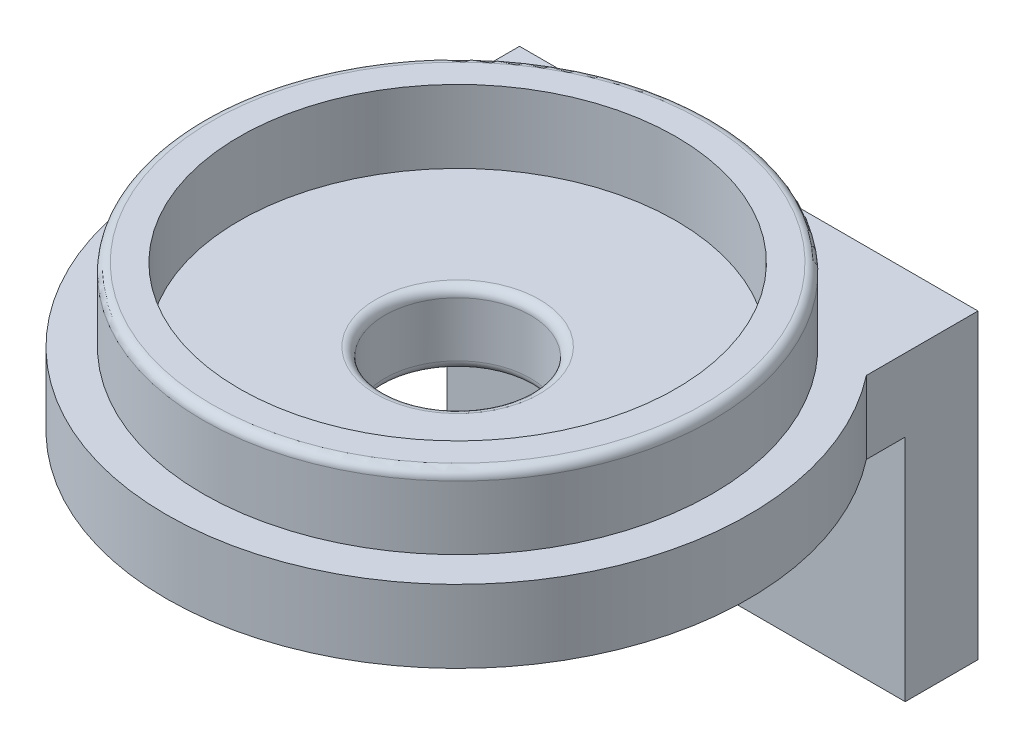
from build123d import *

# Parameters (mm, degrees)
FILLET1_R           = 0.79375
BOSS_EXTRUDE1_DEPTH = 20
SKETCH3_R           = 2.1
CUT_EXTRUDE1_DEPTH  = 57.196468922


with BuildPart() as part:
    # Sketch1 → Revolve1 (revolve)
    with BuildSketch(Plane(origin=(0, 0, 0), x_dir=(0, 0, -1), z_dir=(1, 0, 0))):
        Polygon((22.225, 9.525), (22.225, 3.175), (25.4, 3.175), (25.4, -3.175), (6.35, -3.175), (6.35, 3.175), (19.05, 3.175), (19.05, 9.525), align=None)
    revolve(axis=Axis((0, -32.325211936, 0), (0, 1, 0)))

    # Fillet1
    fillet1_edges = [part.edges().sort_by_distance(p)[0] for p in [
        (0, 9.525, 22.225),
        (0, -3.175, 6.35),
        (0, 3.175, 6.35),
    ]]
    fillet(fillet1_edges, radius=FILLET1_R)

    # Sketch2 → Boss-Extrude1 (add, symmetric)
    with BuildSketch(Plane(origin=(0, 0, 0), x_dir=(0, 0, -1), z_dir=(1, 0, 0))):
        Polygon((25.4, 3.175), (12.7, 3.175), (12.7, -3.175), (19.05, -3.175), (19.05, -23.174999878), (25.4, -23.174999878), (25.4, -3.175), align=None)
    extrude(amount=BOSS_EXTRUDE1_DEPTH, both=True)

    # Sketch3 → Cut-Extrude1 (cut, through all)
    with BuildSketch(Plane.XY.offset(-19.05)):
        with Locations((-10, -13.175)):
            Circle(SKETCH3_R)
        with Locations((10, -13.175)):
            Circle(SKETCH3_R)
    extrude(amount=-CUT_EXTRUDE1_DEPTH, mode=Mode.SUBTRACT)


solid = part.part
